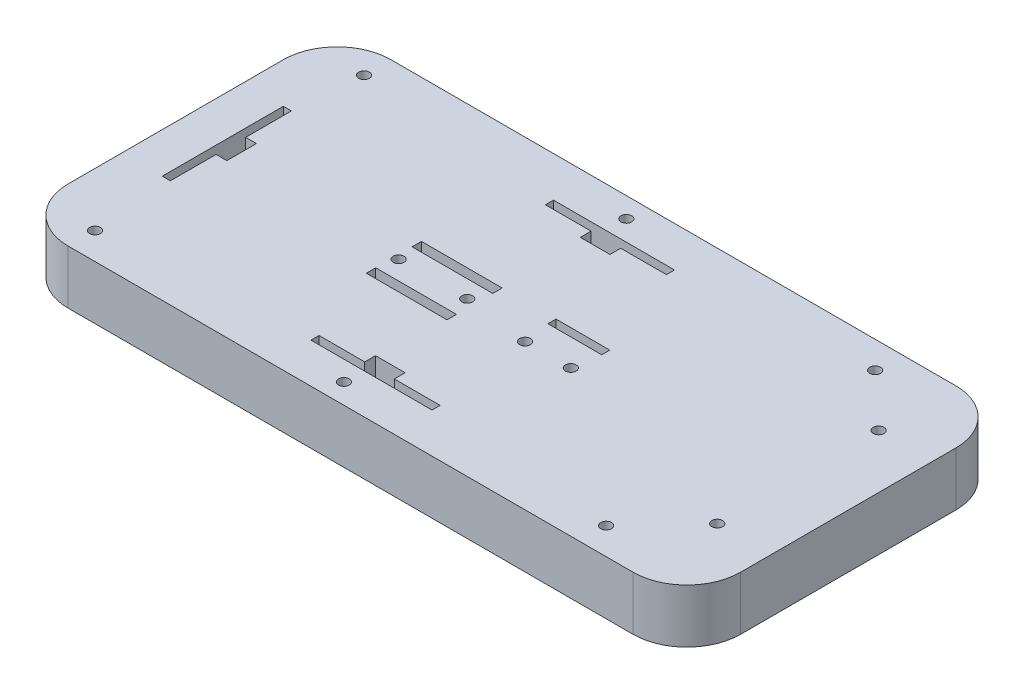
from build123d import *

# Parameters (mm, degrees)
CROQUIS1_R              = 2
CROQUIS1_W              = 30
CROQUIS1_H              = 3
CROQUIS1_W_2            = 20
SALIENTE_EXTRUIR2_DEPTH = 20
CROQUIS2_R              = 15
SALIENTE_EXTRUIR3_DEPTH = 20
CORTAR_EXTRUIR2_START   = -10
CROQUIS4_R              = 2
CROQUIS4_W              = 30
CROQUIS4_H              = 3
CORTAR_EXTRUIR2_DEPTH   = 10
CORTAR_EXTRUIR3_START   = -17
CROQUIS5_R              = 2
CROQUIS5_W              = 30
CROQUIS5_H              = 3.5
CORTAR_EXTRUIR3_DEPTH   = 17
SALIENTE_EXTRUIR4_START = -6
CROQUIS7_R              = 2
SALIENTE_EXTRUIR4_DEPTH = 6
CROQUIS8_R              = 2
CORTAR_EXTRUIR4_DEPTH   = 6


with BuildPart() as part:
    # Croquis1 → Saliente-Extruir2 (new body)
    with BuildSketch(Plane(origin=(0, 0, 0), x_dir=(1, 0, 0), z_dir=(0, 1, 0))):
        with BuildLine():
            Line((20, 0), (230, 0))
            ThreePointArc((230, 0), (244.142135624, 5.857864376), (250, 20))
            Line((250, 20), (250, 100))
            ThreePointArc((250, 100), (244.142135624, 114.142135624), (230, 120))
            Line((230, 120), (20, 120))
            ThreePointArc((20, 120), (5.857864376, 114.142135624), (0, 100))
            Line((0, 100), (0, 20))
            ThreePointArc((0, 20), (5.857864376, 5.857864376), (20, 0))
        make_face()
        with Locations((115, 112.5)):
            Circle(CROQUIS1_R, mode=Mode.SUBTRACT)
        with Locations((115, 7.5)):
            Circle(CROQUIS1_R, mode=Mode.SUBTRACT)
        with Locations((20, 110)):
            Circle(CROQUIS1_R, mode=Mode.SUBTRACT)
        with Locations((20, 10)):
            Circle(CROQUIS1_R, mode=Mode.SUBTRACT)
        with Locations((210, 110)):
            Circle(CROQUIS1_R, mode=Mode.SUBTRACT)
        with Locations((210, 10)):
            Circle(CROQUIS1_R, mode=Mode.SUBTRACT)
        with Locations((230, 31.303267232)):
            Circle(CROQUIS1_R, mode=Mode.SUBTRACT)
        with Locations((230, 91.303267232)):
            Circle(CROQUIS1_R, mode=Mode.SUBTRACT)
        with Locations((87.177665307, 57.171940588)):
            Circle(CROQUIS1_R, mode=Mode.SUBTRACT)
        with Locations((111.177665307, 57.171940588)):
            Circle(CROQUIS1_R, mode=Mode.SUBTRACT)
        with Locations((135.677665307, 54.171940588)):
            Circle(CROQUIS1_R, mode=Mode.SUBTRACT)
        with Locations((152.677665307, 54.171940588)):
            Circle(CROQUIS1_R, mode=Mode.SUBTRACT)
        Polygon((123.413193564, 17.842204256), (140.413193564, 17.842204256), (140.413193564, 14.842204256), (95.413193564, 14.842204256), (95.413193564, 17.842204256), (112.413193564, 17.842204256), (112.413193564, 21.842204256), (123.413193564, 21.842204256), align=None, mode=Mode.SUBTRACT)
        Polygon((15, 85), (18, 85), (18, 68), (22, 68), (22, 57), (18, 57), (18, 40), (15, 40), align=None, mode=Mode.SUBTRACT)
        Polygon((95.413193564, 102), (112.413193564, 102), (112.413193564, 98), (123.413193564, 98), (123.413193564, 102), (140.413193564, 102), (140.413193564, 105), (95.413193564, 105), align=None, mode=Mode.SUBTRACT)
        with Locations((99.177665307, 65.671940588)):
            Rectangle(CROQUIS1_W, CROQUIS1_H, mode=Mode.SUBTRACT)
        with Locations((99.177665307, 48.671940588)):
            Rectangle(CROQUIS1_W, CROQUIS1_H, mode=Mode.SUBTRACT)
        with Locations((144.177665307, 65.671940588)):
            Rectangle(CROQUIS1_W_2, CROQUIS1_H, mode=Mode.SUBTRACT)
    extrude(amount=SALIENTE_EXTRUIR2_DEPTH)

    # Croquis2 → Saliente-Extruir3 (add)
    with BuildSketch(Plane(origin=(0, 20, 0), x_dir=(1, 0, 0), z_dir=(0, 1, 0))):
        with Locations((115, 60)):
            Circle(CROQUIS2_R)
    extrude(amount=-SALIENTE_EXTRUIR3_DEPTH)

    # Croquis4 → Cortar-Extruir2 (cut)
    with BuildSketch(Plane(origin=(0, 20, 0), x_dir=(1, 0, 0), z_dir=(0, 1, 0)).offset(CORTAR_EXTRUIR2_START)):
        with Locations((111.177665307, 57.171940588)):
            Circle(CROQUIS4_R)
        with Locations((87.177665307, 57.171940588)):
            Circle(CROQUIS4_R)
        with Locations((99.177665307, 65.671940588)):
            Rectangle(CROQUIS4_W, CROQUIS4_H)
        with Locations((99.177665307, 48.671940588)):
            Rectangle(CROQUIS4_W, CROQUIS4_H)
    extrude(amount=CORTAR_EXTRUIR2_DEPTH, mode=Mode.SUBTRACT)

    # Croquis5 → Cortar-Extruir3 (cut)
    with BuildSketch(Plane(origin=(0, 20, 0), x_dir=(1, 0, 0), z_dir=(0, 1, 0)).offset(CORTAR_EXTRUIR3_START)):
        with Locations((87.177665307, 57.171940588)):
            Circle(CROQUIS5_R)
        with Locations((99.177665307, 65.421940588)):
            Rectangle(CROQUIS5_W, CROQUIS5_H)
        with Locations((99.177665307, 48.421940588)):
            Rectangle(CROQUIS5_W, CROQUIS5_H)
    extrude(amount=CORTAR_EXTRUIR3_DEPTH, mode=Mode.SUBTRACT)

    # Croquis7 → Saliente-Extruir4 (add)
    with BuildSketch(Plane(origin=(0, 20, 0), x_dir=(1, 0, 0), z_dir=(0, 1, 0)).offset(SALIENTE_EXTRUIR4_START)):
        with Locations((87.177665307, 57.171940588)):
            Circle(CROQUIS7_R)
    extrude(amount=SALIENTE_EXTRUIR4_DEPTH)

    # Croquis8 → Cortar-Extruir4 (cut)
    with BuildSketch(Plane(origin=(0, 20, 0), x_dir=(1, 0, 0), z_dir=(0, 1, 0))):
        with Locations((85.677665307, 57.171940588)):
            Circle(CROQUIS8_R)
    extrude(amount=-CORTAR_EXTRUIR4_DEPTH, mode=Mode.SUBTRACT)


solid = part.part
